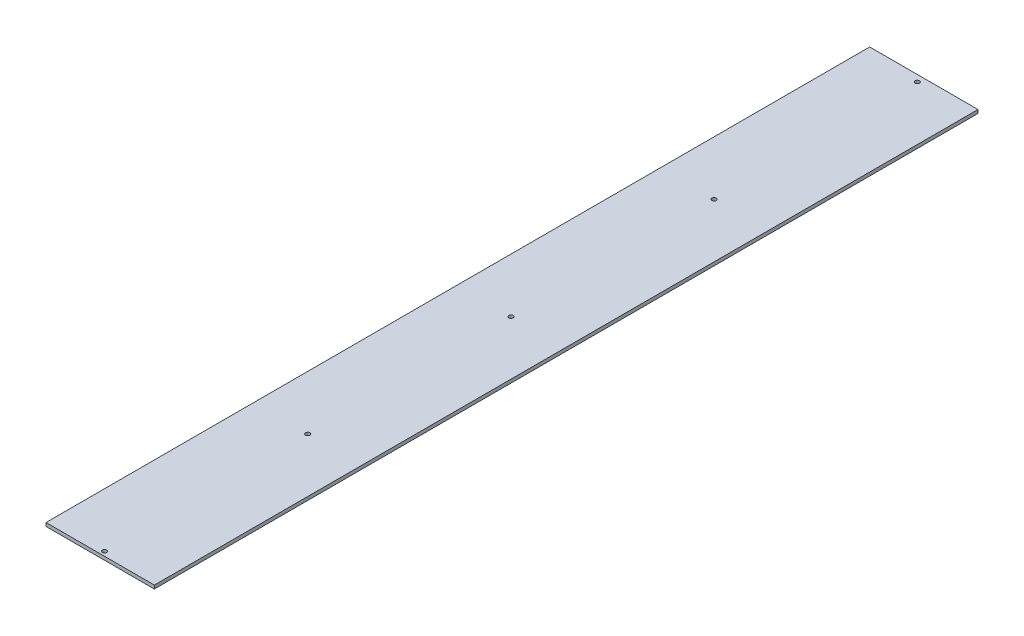
from build123d import *

# Parameters (mm, degrees)
SKETCH1_W          = 50
SKETCH1_H          = 380.15
BASE_FLANGE1_DEPTH = 1.6
SKETCH6_R          = 1
CUT_EXTRUDE1_DEPTH = 10
LPATTERN1_COUNT    = 5
LPATTERN1_PITCH    = 93.7875


# Sheet-metal steps are written as plain solids
with BuildPart() as part:
    # Sketch1 → Base-Flange1 (new body)
    with BuildSketch(Plane(origin=(0, 0, 0), x_dir=(1, 0, 0), z_dir=(0, 1, 0))):
        Rectangle(SKETCH1_W, SKETCH1_H)
    extrude(amount=-BASE_FLANGE1_DEPTH)

    # Sketch6 → Cut-Extrude1 (cut)
    with BuildSketch(Plane(origin=(0, 0, 0), x_dir=(1, 0, 0), z_dir=(0, 1, 0))):
        with Locations(Location((0, 187.075, 0), (0, 0, 270))):
            Circle(SKETCH6_R)
    cut_extrude1 = extrude(amount=-CUT_EXTRUDE1_DEPTH, mode=Mode.SUBTRACT)

    # LPattern1: Cut-Extrude1 ×5
    with Locations(*[(0, 0, i * LPATTERN1_PITCH) for i in range(1, LPATTERN1_COUNT)]):
        add(cut_extrude1, mode=Mode.SUBTRACT)


solid = part.part
